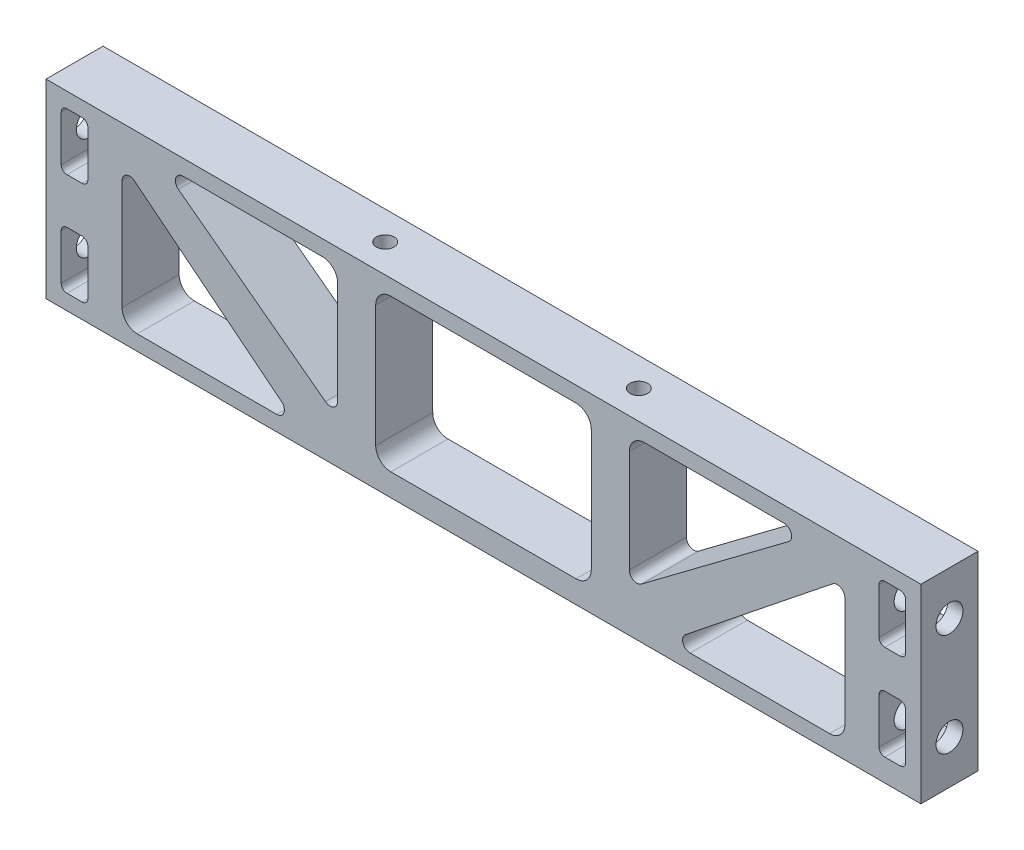
from build123d import *

# Parameters (mm, degrees)
BOSS_EXTRUDE2_DEPTH                        = 9.525
SKETCH3_R                                  = 2.2479
CUT_EXTRUDE1_DEPTH                         = 11.1125
SKETCH4_R                                  = 1.4732
CUT_EXTRUDE2_DEPTH                         = 12.7
MIRROR2_AT_THE_SECOND_PLANE_COPY_1_SKETC_R = 1.4732
MIRROR2_AT_THE_SECOND_PLANE_COPY_1_DEPTH   = 12.7


with BuildPart() as part:
    # Sketch2 → Boss-Extrude2 (new body)
    with BuildSketch(Plane.XY):
        Polygon((-63.5, 15.299999878), (-73.025, 15.299999878), (-73.025, -16.450000122), (-63.5, -16.450000122), (-21.166666667, -16.450000122), (0, -16.450000122), (73.025, -16.450000122), (73.025, 15.299999878), (-21.166666667, 15.299999878), (-24.341666667, 15.299999878), align=None)
        with BuildLine():
            Line((-66.04, -5.340000244), (-66.04, -12.960000244))
            ThreePointArc((-66.04, -12.960000244), (-66.318980791, -13.633519453), (-66.9925, -13.912500244))
            Line((-66.9925, -13.912500244), (-69.5325, -13.912500244))
            ThreePointArc((-69.5325, -13.912500244), (-70.206019209, -13.633519453), (-70.485, -12.960000244))
            Line((-70.485, -12.960000244), (-70.485, -5.340000244))
            ThreePointArc((-70.485, -5.340000244), (-70.206019209, -4.666481035), (-69.5325, -4.387500244))
            Line((-69.5325, -4.387500244), (-66.9925, -4.387500244))
            ThreePointArc((-66.9925, -4.387500244), (-66.318980791, -4.666481035), (-66.04, -5.340000244))
        make_face(mode=Mode.SUBTRACT)
        with BuildLine():
            ThreePointArc((-57.785, -13.912500244), (-59.581051224, -13.168551468), (-60.325, -11.372500244))
            Line((-60.325, -11.372500244), (-60.325, 6.985))
            ThreePointArc((-60.325, 6.985), (-59.605365306, 8.129551454), (-58.262010976, 7.977002221))
            Line((-58.262010976, 7.977002221), (-33.708677642, -11.650498023))
            ThreePointArc((-33.708677642, -11.650498023), (-33.303179533, -13.062653299), (-34.501666667, -13.912500244))
            Line((-34.501666667, -13.912500244), (-57.785, -13.912500244))
        make_face(mode=Mode.SUBTRACT)
        with BuildLine():
            ThreePointArc((70.485, -11.7475), (70.206019209, -12.421019209), (69.5325, -12.7))
            Line((69.5325, -12.7), (66.9925, -12.7))
            ThreePointArc((66.9925, -12.7), (66.318980791, -12.421019209), (66.04, -11.7475))
            Line((66.04, -11.7475), (66.04, -4.1275))
            ThreePointArc((66.04, -4.1275), (66.318980791, -3.453980791), (66.9925, -3.175))
            Line((66.9925, -3.175), (69.5325, -3.175))
            ThreePointArc((69.5325, -3.175), (70.206019209, -3.453980791), (70.485, -4.1275))
            Line((70.485, -4.1275), (70.485, -11.7475))
        make_face(mode=Mode.SUBTRACT)
        with BuildLine():
            ThreePointArc((60.325, -11.372500244), (59.581051224, -13.168551468), (57.785, -13.912500244))
            Line((57.785, -13.912500244), (34.501666667, -13.912500244))
            ThreePointArc((34.501666667, -13.912500244), (33.303179533, -13.062653299), (33.708677642, -11.650498023))
            Line((33.708677642, -11.650498023), (58.262010976, 7.977002221))
            ThreePointArc((58.262010976, 7.977002221), (59.605365306, 8.129551454), (60.325, 6.985))
            Line((60.325, 6.985), (60.325, -11.372500244))
        make_face(mode=Mode.SUBTRACT)
        with BuildLine():
            Line((-26.373666667, -8.001), (-50.927, 10.414))
            ThreePointArc((-50.927, 10.414), (-51.369827789, 11.831609263), (-50.165, 12.7))
            Line((-50.165, 12.7), (-26.881666667, 12.7))
            ThreePointArc((-26.881666667, 12.7), (-25.085615442, 11.956051224), (-24.341666667, 10.16))
            Line((-24.341666667, 10.16), (-24.341666667, -6.985))
            ThreePointArc((-24.341666667, -6.985), (-25.0437054, -8.120922533), (-26.373666667, -8.001))
        make_face(mode=Mode.SUBTRACT)
        with BuildLine():
            ThreePointArc((-70.485, 11.81), (-70.206019209, 12.483519209), (-69.5325, 12.7625))
            Line((-69.5325, 12.7625), (-66.9925, 12.7625))
            ThreePointArc((-66.9925, 12.7625), (-66.318980791, 12.483519209), (-66.04, 11.81))
            Line((-66.04, 11.81), (-66.04, 4.19))
            ThreePointArc((-66.04, 4.19), (-66.318980791, 3.516480791), (-66.9925, 3.2375))
            Line((-66.9925, 3.2375), (-69.5325, 3.2375))
            ThreePointArc((-69.5325, 3.2375), (-70.206019209, 3.516480791), (-70.485, 4.19))
            Line((-70.485, 4.19), (-70.485, 11.81))
        make_face(mode=Mode.SUBTRACT)
        with BuildLine():
            ThreePointArc((-17.991666667, 10.16), (-17.247717891, 11.956051224), (-15.451666667, 12.7))
            Line((-15.451666667, 12.7), (15.451666667, 12.7))
            ThreePointArc((15.451666667, 12.7), (17.247717891, 11.956051224), (17.991666667, 10.16))
            Line((17.991666667, 10.16), (17.991666667, -10.16))
            ThreePointArc((17.991666667, -10.16), (17.247717891, -11.956051224), (15.451666667, -12.7))
            Line((15.451666667, -12.7), (-15.451666667, -12.7))
            ThreePointArc((-15.451666667, -12.7), (-17.247717891, -11.956051224), (-17.991666667, -10.16))
            Line((-17.991666667, -10.16), (-17.991666667, 10.16))
        make_face(mode=Mode.SUBTRACT)
        with BuildLine():
            Line((24.341666667, -6.985), (24.341666667, 10.16))
            ThreePointArc((24.341666667, 10.16), (25.085615442, 11.956051224), (26.881666667, 12.7))
            Line((26.881666667, 12.7), (50.165, 12.7))
            ThreePointArc((50.165, 12.7), (51.369827789, 11.831609263), (50.927, 10.414))
            Line((50.927, 10.414), (26.373666667, -8.001))
            ThreePointArc((26.373666667, -8.001), (25.0437054, -8.120922533), (24.341666667, -6.985))
        make_face(mode=Mode.SUBTRACT)
        with BuildLine():
            Line((66.04, 4.1275), (66.04, 11.7475))
            ThreePointArc((66.04, 11.7475), (66.318980791, 12.421019209), (66.9925, 12.7))
            Line((66.9925, 12.7), (69.5325, 12.7))
            ThreePointArc((69.5325, 12.7), (70.206019209, 12.421019209), (70.485, 11.7475))
            Line((70.485, 11.7475), (70.485, 4.1275))
            ThreePointArc((70.485, 4.1275), (70.206019209, 3.453980791), (69.5325, 3.175))
            Line((69.5325, 3.175), (66.9925, 3.175))
            ThreePointArc((66.9925, 3.175), (66.318980791, 3.453980791), (66.04, 4.1275))
        make_face(mode=Mode.SUBTRACT)
    extrude(amount=BOSS_EXTRUDE2_DEPTH)

    # Sketch3 → Cut-Extrude1 (cut)
    with BuildSketch(Plane.ZY.offset(73.025)):
        with Locations((4.7625, 7.999999878)):
            Circle(SKETCH3_R)
        with Locations((4.7625, -9.150000122)):
            Circle(SKETCH3_R)
    cut_extrude1 = extrude(amount=-CUT_EXTRUDE1_DEPTH, mode=Mode.SUBTRACT)

    # Sketch4 → Cut-Extrude2 (cut)
    with BuildSketch(Plane(origin=(0, 15.299999878, 0), x_dir=(1, 0, 0), z_dir=(0, 1, 0))):
        with Locations((21.166666667, -4.7625)):
            Circle(SKETCH4_R)
    cut_extrude2 = extrude(amount=-CUT_EXTRUDE2_DEPTH, mode=Mode.SUBTRACT)

    # Mirror2: Cut-Extrude2 across plane
    add(cut_extrude2.mirror(Plane.ZX.offset(-0.575000122)), mode=Mode.SUBTRACT)

    # Mirror2 at the second plane: Cut-Extrude2 across plane
    add(cut_extrude2.mirror(Plane(origin=(0, 0, 0), x_dir=(0, 0, 1), z_dir=(1, 0, 0))), mode=Mode.SUBTRACT)

    # Mirror2 at the second plane copy 1 sketc → Mirror2 at the second plane copy 1 (cut)
    with BuildSketch(Plane(origin=(0, -16.450000122, 0), x_dir=(-1, 0, 0), z_dir=(0, -1, 0))):
        with Locations((21.166666667, -4.7625)):
            Circle(MIRROR2_AT_THE_SECOND_PLANE_COPY_1_SKETC_R)
    extrude(amount=-MIRROR2_AT_THE_SECOND_PLANE_COPY_1_DEPTH, mode=Mode.SUBTRACT)

    # Mirror3: Cut-Extrude1 across plane
    add(cut_extrude1.mirror(Plane(origin=(0, 0, 0), x_dir=(0, 0, 1), z_dir=(1, 0, 0))), mode=Mode.SUBTRACT)


solid = part.part
